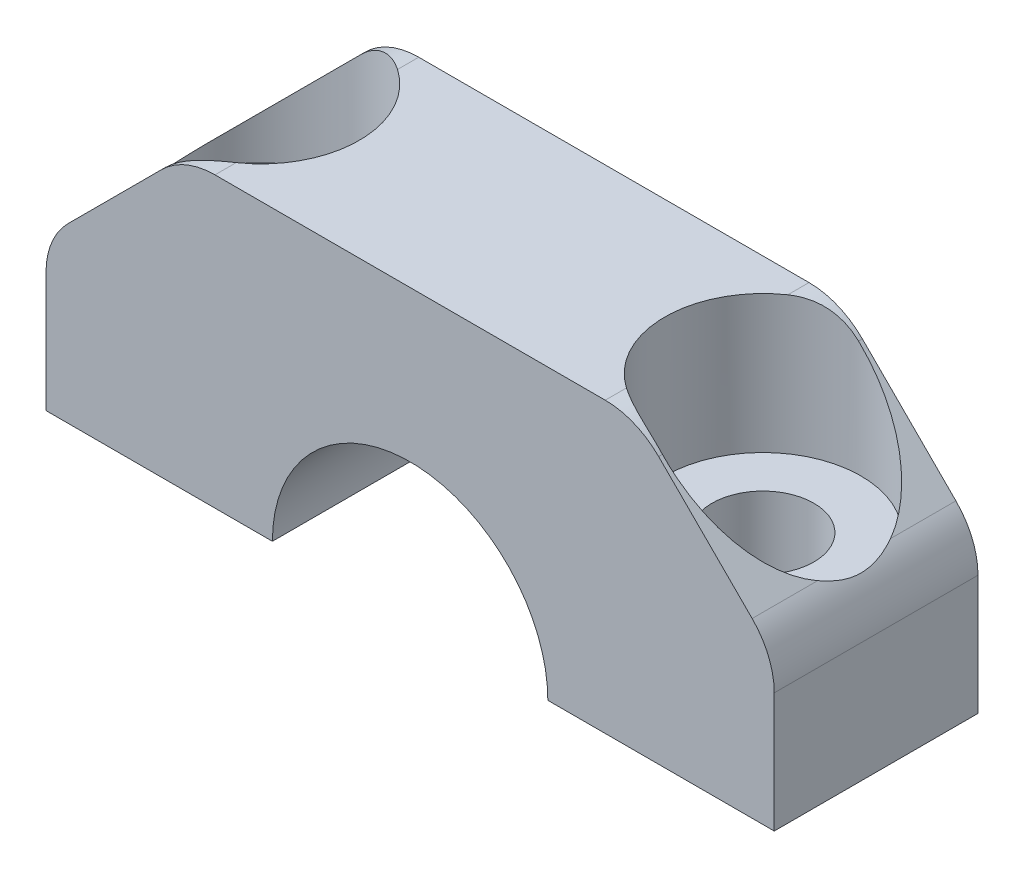
from build123d import *

# Parameters (mm, degrees)
BOSS_EXTRUDE1_DEPTH     = 6.858
CUT_EXTRUDE1_DEPTH      = 18.07689622
CUT_EXTRUDE1_DEPTH_BACK = 18.07689622
SKETCH3_R               = 1.7145
CUT_EXTRUDE2_DEPTH      = 18.07689622
SKETCH5_R               = 3.302
CUT_EXTRUDE3_DEPTH      = 15.934384629
FILLET1_R               = 2.54
FILLET2_R               = 2.54


with BuildPart() as part:
    # Sketch2 → Boss-Extrude1 (new body)
    with BuildSketch(Plane.XY):
        with BuildLine():
            Line((-12.2555, 9.7155), (12.2555, 9.7155))
            Line((12.2555, 9.7155), (12.2555, 0))
            Line((12.2555, 0), (4.6355, 0))
            ThreePointArc((4.6355, 0), (0, 4.6355), (-4.6355, 0))
            Line((-4.6355, 0), (-12.2555, 0))
            Line((-12.2555, 0), (-12.2555, 9.7155))
        make_face()
    extrude(amount=BOSS_EXTRUDE1_DEPTH)

    # Sketch3 → Cut-Extrude1 (cut, two sides: drawn at the far end of the back side and taken through both)
    with BuildSketch(Plane.XZ.offset(-CUT_EXTRUDE1_DEPTH_BACK)):
        with Locations(Location((-8.4455, 3.429, 0), (0, 0, 270))):
            Circle(SKETCH3_R)
        with Locations(Location((8.4455, 3.429, 0), (0, 0, 270))):
            Circle(SKETCH3_R)
    extrude(amount=CUT_EXTRUDE1_DEPTH + CUT_EXTRUDE1_DEPTH_BACK, mode=Mode.SUBTRACT)

    # Sketch4 → Cut-Extrude2 (cut, through all)
    with BuildSketch(Plane.XY.offset(6.858)):
        Polygon((-12.2555, 5.08), (-7.62, 9.7155), (-12.2555, 9.7155), align=None)
        Polygon((12.2555, 9.7155), (7.62, 9.7155), (12.2555, 5.08), align=None)
    extrude(amount=-CUT_EXTRUDE2_DEPTH, mode=Mode.SUBTRACT)

    # Sketch5 → Cut-Extrude3 (cut, through all)
    with BuildSketch(Plane(origin=(0, 5.08, 0), x_dir=(1, 0, 0), z_dir=(0, 1, 0))):
        with Locations(Location((-8.4455, -3.429, 0), (0, 0, 284.477512186))):
            Circle(SKETCH5_R)
        with Locations(Location((8.4455, -3.429, 0), (0, 0, 104.477512186))):
            Circle(SKETCH5_R)
    extrude(amount=CUT_EXTRUDE3_DEPTH, mode=Mode.SUBTRACT)

    # Fillet1
    # the kernel refuses this fillet: 2.54 mm, written as the material it takes off along each edge
    with BuildSketch(Plane(origin=(7.62, 9.7155, 2.862108369), x_dir=(0.707106781186544, -0.7071067811865508, 0), z_dir=(0, 0, -1)), Plane(origin=(7.62, 9.7155, 9.488256121), x_dir=(0.707106781186544, -0.7071067811865508, 0), z_dir=(0, 0, -1)), Plane(origin=(-7.62, 9.7155, 9.488256121), x_dir=(1, 0, 0), z_dir=(0, 0, -1)), Plane(origin=(-7.62, 9.7155, 2.862108369), x_dir=(1, 0, 0), z_dir=(0, 0, -1))) as fillet1_piece_1:
        with BuildLine():
            CenterArc((FILLET1_R * 0.414213562373, FILLET1_R), FILLET1_R, 225, 45)
            Line((-FILLET1_R * 0.292893218813, FILLET1_R * 0.292893218813), (0, 0))
            Line((0, 0), (FILLET1_R * 0.414213562373, 0))
        make_face()
    extrude(amount=5.49236449, mode=Mode.SUBTRACT)

    # Fillet2
    # the kernel refuses this fillet: 2.54 mm, written as the material it takes off along each edge
    with BuildSketch(Plane(origin=(-12.2555, 5.08, 9.488256121), x_dir=(0, -1, 0), z_dir=(0, 0, -1))) as fillet2_piece_1:
        with BuildLine():
            CenterArc((FILLET2_R * 0.414213562373, -FILLET2_R), FILLET2_R, 90, 45)
            Line((-FILLET2_R * 0.292893218813, -FILLET2_R * 0.292893218813), (0, 0))
            Line((0, 0), (FILLET2_R * 0.414213562373, 0))
        make_face()
    extrude(amount=12.118512242, mode=Mode.SUBTRACT)
    with BuildSketch(Plane(origin=(12.2555, 5.08, 9.488256121), x_dir=(0, -1, 0), z_dir=(0, 0, -1))) as fillet2_piece_2:
        with BuildLine():
            CenterArc((FILLET2_R * 0.414213562373, FILLET2_R), FILLET2_R, 225, 45)
            Line((-FILLET2_R * 0.292893218813, FILLET2_R * 0.292893218813), (0, 0))
            Line((0, 0), (FILLET2_R * 0.414213562373, 0))
        make_face()
    extrude(amount=12.118512242, mode=Mode.SUBTRACT)


solid = part.part
